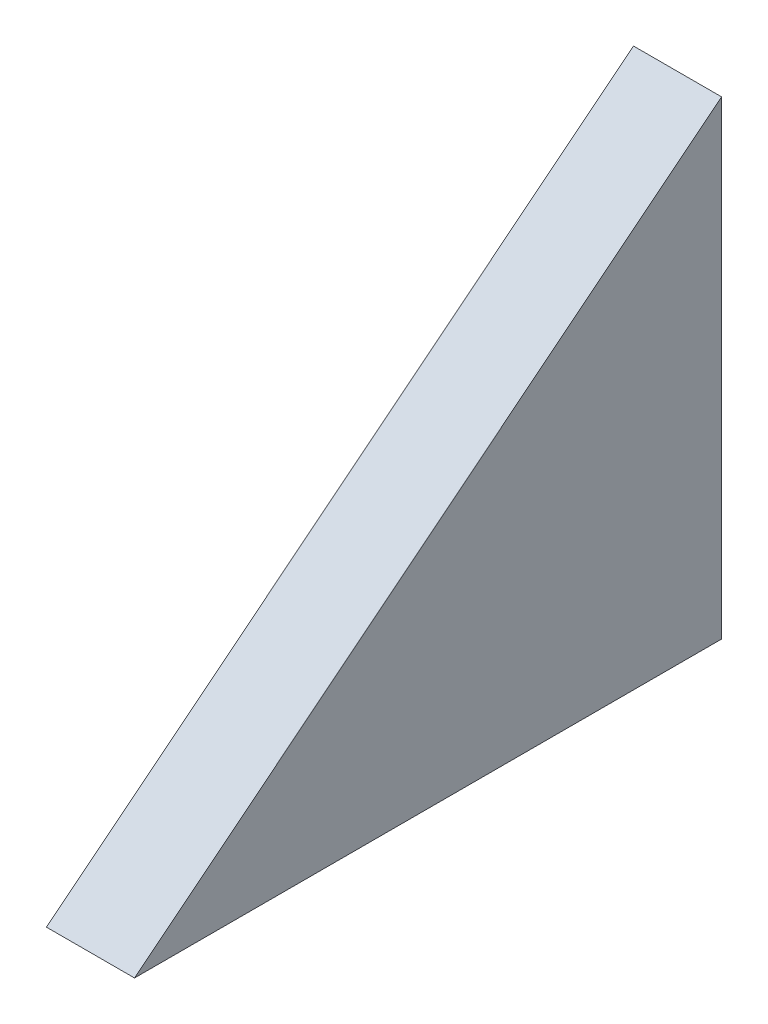
from build123d import *

# Parameters (mm, degrees)
BOSS_EXTRUDE1_DEPTH = 19.05


with BuildPart() as part:
    # Sketch1 → Boss-Extrude1 (new body)
    with BuildSketch(Plane(origin=(0, 0, 0), x_dir=(0, 0, -1), z_dir=(1, 0, 0))):
        Polygon((-41.262689439, 95.214777322), (-168.262689439, -6.385222678), (-41.262689439, -6.385222678), align=None)
    extrude(amount=BOSS_EXTRUDE1_DEPTH)


solid = part.part
